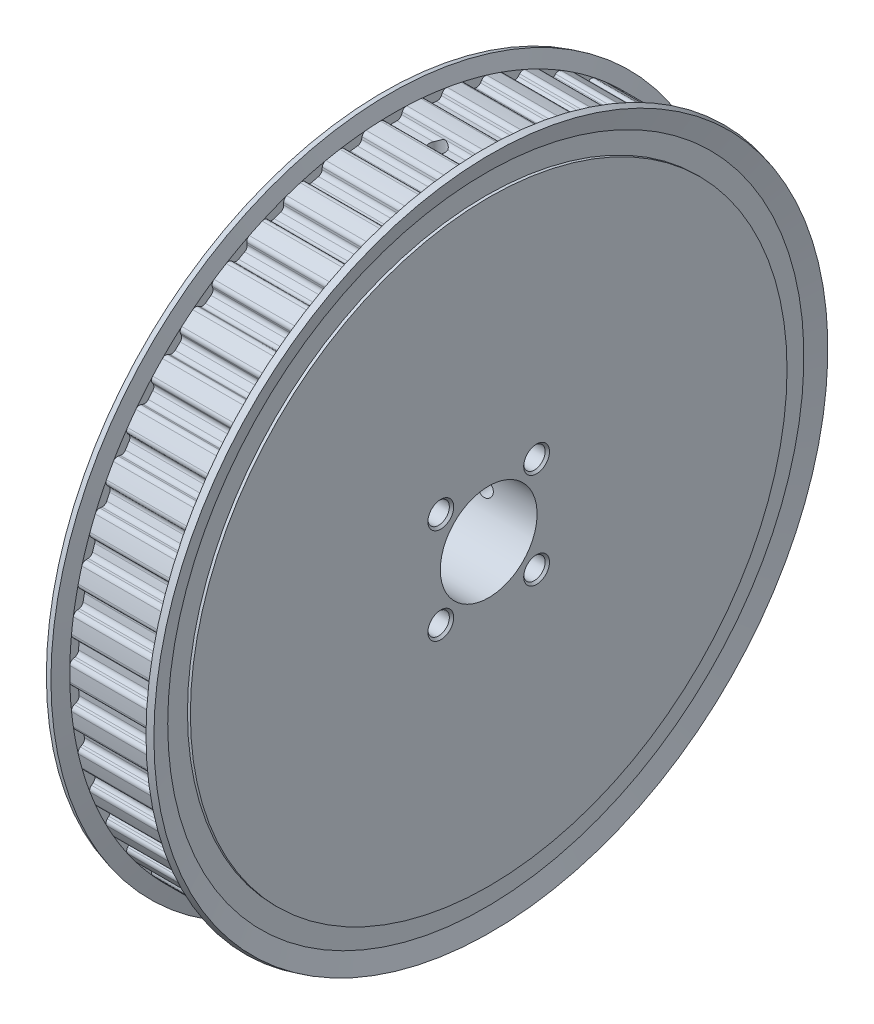
from build123d import *

# Parameters (mm, degrees)
SKETCH_2_W                  = 32
SKETCH_2_H                  = 15
CUT_EXTRUDE_1_DEPTH         = 27
PATTERN_CIRCULAR_1_COUNT    = 50
SKETCH_5_W                  = 2.4585
SKETCH_5_H                  = 100.38
PATTERN_LINEAR_1_COUNT      = 2
PATTERN_LINEAR_1_PITCH      = 29.69848481
PATTERN_LINEAR_1_COUNT_DIR2 = 2
PATTERN_LINEAR_1_PITCH_DIR2 = 29.69848481


with BuildPart() as part:
    # 草图1 → 旋转1 (revolve)
    with BuildSketch(Plane.XY):
        Polygon((0, 0), (0, 92.5), (0.9, 92.5), (0.9, 98.623874682), (-0.669776922, 104.48236191), (1.262074731, 105), (2.5, 100.38), (29.5, 100.38), (30.737925269, 105), (32.669776922, 104.48236191), (31.1, 98.623874682), (31.1, 92.5), (32, 92.5), (32, 0), align=None)
    revolve(axis=Axis((32, 0, 0), (-1, 0, 0)))

    # 草图2 → 切除-旋转1 (revolve, cut)
    with BuildSketch(Plane.XY):
        with Locations((16, 7.5)):
            Rectangle(SKETCH_2_W, SKETCH_2_H)
    revolve(axis=Axis((32, 0, 0), (-1, 0, 0)), mode=Mode.SUBTRACT)

    # 草图3 → 切除-拉伸1 (cut)
    with BuildSketch(Plane(origin=(2.5, 0, 0), x_dir=(0, 0, -1), z_dir=(1, 0, 0))):
        with BuildLine():
            Line((-2.701020112, 99.363357082), (-2.478202205, 98.751169914))
            ThreePointArc((-2.478202205, 98.751169914), (-1.933345306, 98.045145753), (-1.080610092, 97.784029278))
            ThreePointArc((-1.080610092, 97.784029278), (0, 97.79), (1.080610092, 97.784029278))
            ThreePointArc((1.080610092, 97.784029278), (1.933345306, 98.045145753), (2.478202205, 98.751169914))
            Line((2.478202205, 98.751169914), (2.701020112, 99.363357082))
            ThreePointArc((2.701020112, 99.363357082), (3.244795767, 100.057252307), (4.09328829, 100.296507372))
            Line((4.09328829, 100.296507372), (4.09328829, 133.84))
            Line((4.09328829, 133.84), (-4.09328829, 133.84))
            Line((-4.09328829, 133.84), (-4.09328829, 100.296507372))
            ThreePointArc((-4.09328829, 100.296507372), (-3.244795767, 100.057252307), (-2.701020112, 99.363357082))
        make_face()
    cut_extrude_1 = extrude(amount=CUT_EXTRUDE_1_DEPTH, mode=Mode.SUBTRACT)

    # 阵列(圆周)1: 切除-拉伸1 ×50 about axis
    pattern_circular_1_axis = Axis((2.5, 0, 0), (1, 0, 0))
    for i in range(1, PATTERN_CIRCULAR_1_COUNT):
        add(cut_extrude_1.rotate(pattern_circular_1_axis, i * 360 / PATTERN_CIRCULAR_1_COUNT), mode=Mode.SUBTRACT)

    # 草图5 → 切除-旋转2 (revolve, cut)
    with BuildSketch(Plane(origin=(16, 0, 0), x_dir=(0, 0, -1), z_dir=(1, 0, 0))):
        with Locations((1.22925, 50.19)):
            Rectangle(SKETCH_5_W, SKETCH_5_H)
    revolve(axis=Axis((16, 0, 0), (0, 1, 0)), mode=Mode.SUBTRACT)

    # 草图6 → 切除-旋转3 (revolve, cut)
    with BuildSketch(Plane(origin=(16, 0, 0), x_dir=(0, 0, -1), z_dir=(1, 0, 0))):
        Polygon((100.181923, -6.30291235), (100.027552507, -8.756561062), (-0.154370492, -2.453648712), (0, 0), align=None)
    revolve(axis=Axis((16, 0, 0), (0, -0.0627905195293132, -0.9980267284282717)), mode=Mode.SUBTRACT)

    # 草图7 → 切除-旋转4 (revolve, cut)
    with BuildSketch(Plane(origin=(0, 0, 0), x_dir=(1, 0, 0), z_dir=(0, -0.7071067811865475, 0.7071067811865476))):
        Polygon((-7.076450952, 21), (-5.157627332, 24.3235), (31.3235, 24.3235), (32, 25), (32, 21), align=None)
    cut_revolve_4 = revolve(axis=Axis((32, 14.849242405, 14.849242405), (-1, 0, 0)), mode=Mode.SUBTRACT)

    # 阵列(线性)1: Cut-Revolve 4 2 × 2
    with Locations(*[(0, -j * PATTERN_LINEAR_1_PITCH_DIR2, -i * PATTERN_LINEAR_1_PITCH) for i in range(PATTERN_LINEAR_1_COUNT) for j in range(PATTERN_LINEAR_1_COUNT_DIR2) if (i, j) != (0, 0)]):
        add(cut_revolve_4, mode=Mode.SUBTRACT)


solid = part.part
